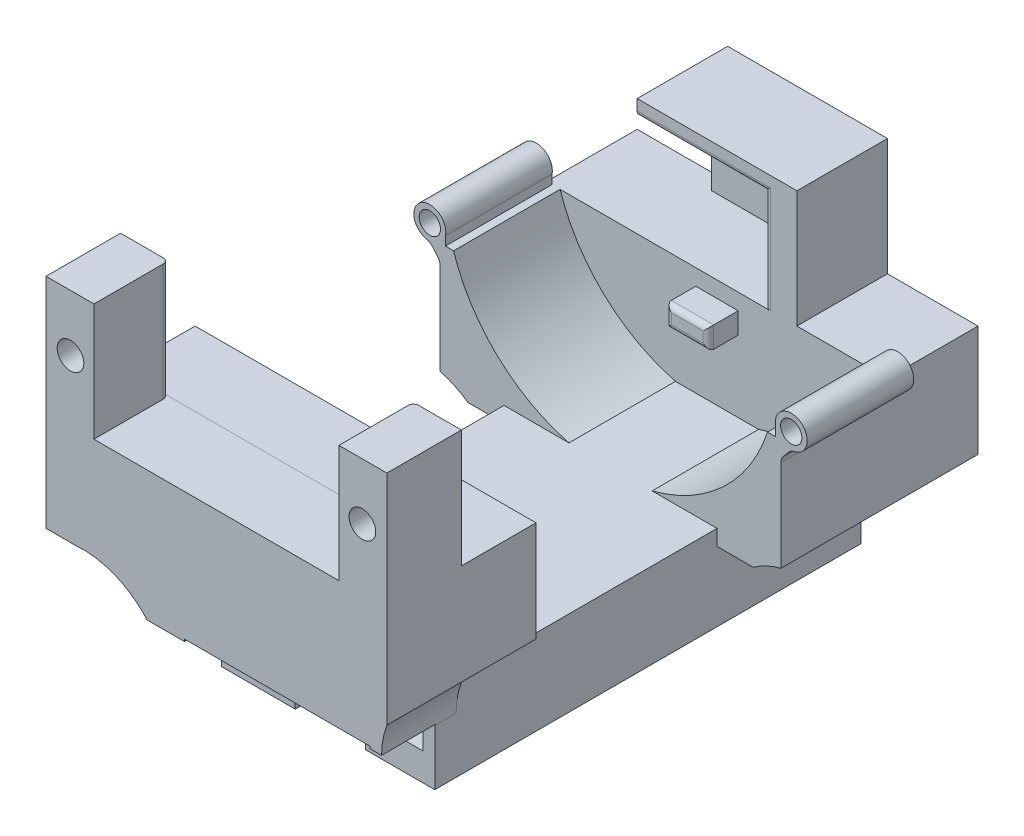
from build123d import *

# Parameters (mm, degrees)
BOSS_EXTRUDE1_DEPTH = 50
SKETCH2_R           = 1.25
BOSS_EXTRUDE2_DEPTH = 7
FILLET1_R           = 8
BOSS_EXTRUDE3_DEPTH = 8.5
SKETCH7_W           = 12
SKETCH7_H           = 9.5
CUT_EXTRUDE1_DEPTH  = 7
BOSS_EXTRUDE4_DEPTH = 10
SKETCH9_W           = 3.98
SKETCH9_H           = 1.98
BOSS_EXTRUDE5_DEPTH = 2.8
SKETCH11_W          = 32
SKETCH11_H          = 9.453112349
BOSS_EXTRUDE6_DEPTH = 7
SKETCH16_R          = 1
BOSS_EXTRUDE7_DEPTH = 10
FILLET2_R           = 1
FILLET4_R           = 0.5
FILLET5_R           = 0.5
FILLET6_R           = 0.5
SKETCH17_R          = 8
CUT_EXTRUDE2_DEPTH  = 61.270972563
SKETCH18_W          = 26.905399266
SKETCH18_H          = 5.924124609
CUT_EXTRUDE3_DEPTH  = 5
SKETCH19_W          = 27.645914842
SKETCH19_H          = 7.775413549
CUT_EXTRUDE4_DEPTH  = 5


with BuildPart() as part:
    # Sketch1 → Boss-Extrude1 (new body)
    with BuildSketch(Plane.XY):
        Polygon((-6.349640288, 0), (-0.949640288, 0), (-0.949640288, -2.6), (-7.849640288, -2.6), (-7.849640288, 5.4), (12.150359712, 5.4), (12.150359712, -2.6), (5.650359712, -2.6), (5.650359712, 0), (11.050359712, 0), (11.050359712, 2.9), (-6.349640288, 2.9), align=None)
    extrude(amount=BOSS_EXTRUDE1_DEPTH)

    # Sketch2 → Boss-Extrude2 (add)
    with BuildSketch(Plane.XY.offset(50)):
        Polygon((-19.349640288, 25.9), (-19.349640288, 5.4), (12.650359712, 5.4), (12.650359712, 25.9), (8.150359712, 25.9), (8.150359712, 14.9), (-14.849640288, 14.9), (-14.849640288, 25.9), align=None)
        with Locations((10.350359712, 20.6)):
            Circle(SKETCH2_R, mode=Mode.SUBTRACT)
        with Locations((-17.049640288, 20.6)):
            Circle(SKETCH2_R, mode=Mode.SUBTRACT)
    extrude(amount=-BOSS_EXTRUDE2_DEPTH)

    # Fillet1
    # the kernel refuses this fillet: 8 mm, written as the material it adds along each edge
    with BuildSketch(Plane(origin=(-7.849640288, 5.4, 43), x_dir=(0, -1, 0), z_dir=(0, 0, 1))) as fillet1_piece_1:
        with BuildLine():
            CenterArc((FILLET1_R, -FILLET1_R), FILLET1_R, 90, 90)
            Line((0, -FILLET1_R), (0, 0))
            Line((0, 0), (FILLET1_R, 0))
        make_face()
    extrude(amount=7)
    with BuildSketch(Plane(origin=(12.150359712, 5.4, 43), x_dir=(0, -1, 0), z_dir=(0, 0, 1))) as fillet1_piece_2:
        with BuildLine():
            CenterArc((2.783882181, 8), FILLET1_R, 249.635865194, 20.364134806)
            Line((0, 0.5), (0, 0))
            Line((0, 0), (2.783882181, 0))
        make_face()
    extrude(amount=7)

    # Sketch4 → Boss-Extrude3 (add)
    with BuildSketch(Plane(origin=(0, 0, 0), x_dir=(-1, 0, 0), z_dir=(0, 0, -1))):
        Polygon((-18.150359712, 15.6), (-18.150359712, 5.1), (13.849640288, 5.1), (13.849640288, 15.6), (5.349640288, 15.6), (5.349640288, 26.6), (-9.650359712, 26.6), (-9.650359712, 15.6), align=None)
    extrude(amount=-BOSS_EXTRUDE3_DEPTH)

    # Sketch7 → Cut-Extrude1 (cut)
    with BuildSketch(Plane.XY.offset(8.5)):
        with Locations((0.650359712, 20.35)):
            Rectangle(SKETCH7_W, SKETCH7_H)
    extrude(amount=-CUT_EXTRUDE1_DEPTH, mode=Mode.SUBTRACT)

    # Sketch8 → Boss-Extrude4 (add)
    with BuildSketch(Plane.XY.offset(8.5)):
        with BuildLine():
            Line((-13.849640288, 15.6), (-12.587686291, 15.6))
            ThreePointArc((-12.587686291, 15.6), (2.150359712, 4.9), (16.888405716, 15.6))
            Line((16.888405716, 15.6), (18.150359712, 15.6))
            Line((18.150359712, 15.6), (18.150359712, 3.937972429))
            Line((18.150359712, 3.937972429), (-13.849640288, 3.937972429))
            Line((-13.849640288, 3.937972429), (-13.849640288, 15.6))
        make_face()
    extrude(amount=BOSS_EXTRUDE4_DEPTH)

    # Sketch9 → Boss-Extrude5 (add)
    with BuildSketch(Plane.XY.offset(8.5)):
        with Locations((2.150359712, 13.1)):
            Rectangle(SKETCH9_W, SKETCH9_H)
    extrude(amount=BOSS_EXTRUDE5_DEPTH)

    # Sketch11 → Boss-Extrude6 (add)
    with BuildSketch(Plane(origin=(0, 0, 43), x_dir=(-1, 0, 0), z_dir=(0, 0, -1))):
        with Locations((3.349640288, 10.126556175)):
            Rectangle(SKETCH11_W, SKETCH11_H)
    extrude(amount=BOSS_EXTRUDE6_DEPTH)

    # Sketch16 → Boss-Extrude7 (add)
    # profile 1 of 2: a face of its own
    with BuildSketch(Plane.XY.offset(18.5)):
        with BuildLine():
            Line((-13.346805139, 15.601949196), (-13.846805139, 15.601949196))
            Line((-13.846805139, 15.601949196), (-13.849640288, 14.1))
            Line((-13.849640288, 14.1), (-14.815015575, 15.247623037))
            ThreePointArc((-14.815015575, 15.247623037), (-15.7608574, 17.911832315), (-13.346805139, 16.44044538))
            Line((-13.346805139, 16.44044538), (-13.346805139, 15.601949196))
        make_face()
        with Locations((-14.815015575, 16.747623037)):
            Circle(SKETCH16_R, mode=Mode.SUBTRACT)
    # profile 2 of 2: a face of its own
    with BuildSketch(Plane.XY.offset(18.5)):
        with BuildLine():
            Line((17.652000257, 15.6), (18.150359712, 15.6))
            Line((18.150359712, 15.6), (18.150359712, 14.1))
            Line((18.150359712, 14.1), (19.116258964, 15.247623037))
            ThreePointArc((19.116258964, 15.247623037), (20.054810716, 17.91771731), (17.652000257, 16.422128892))
            Line((17.652000257, 16.422128892), (17.652000257, 15.6))
        make_face()
        with Locations((19.116258964, 16.747623037)):
            Circle(SKETCH16_R, mode=Mode.SUBTRACT)
    extrude(amount=-BOSS_EXTRUDE7_DEPTH)

    # Fillet2
    fillet2_edges = [part.edges().sort_by_distance(p)[0] for p in [
        (-13.849640288, 14.1, 13.5),
        (-14.815015575, 15.247623037, 13.5),
        (19.116258964, 15.247623037, 13.5),
        (18.150359712, 14.1, 13.5),
    ]]
    fillet(fillet2_edges, radius=FILLET2_R)

    # Fillet4
    fillet4_edges = [part.edges().sort_by_distance(p)[0] for p in [
        (0.160359712, 13.1, 11.3),
        (2.150359712, 12.11, 11.3),
        (4.140359712, 13.1, 11.3),
        (2.150359712, 14.09, 11.3),
    ]]
    fillet(fillet4_edges, radius=FILLET4_R)

    # Fillet5
    fillet5_edges = [part.edges().sort_by_distance(p)[0] for p in [
        (6.650359712, 20.35, 8.5),
        (0.650359712, 25.1, 8.5),
    ]]
    fillet(fillet5_edges, radius=FILLET5_R)

    # Fillet6
    fillet6_edges = [part.edges().sort_by_distance(p)[0] for p in [
        (-14.849640288, 20.4, 43),
        (8.150359712, 20.4, 43),
    ]]
    fillet(fillet6_edges, radius=FILLET6_R)

    # Sketch17 → Cut-Extrude2 (cut, through all)
    with BuildSketch(Plane.XY.offset(50)):
        with Locations((-15.895053234, -2.569483857)):
            Circle(SKETCH17_R)
        with Locations((20.210973801, -2.569483857)):
            Circle(SKETCH17_R)
    extrude(amount=-CUT_EXTRUDE2_DEPTH, mode=Mode.SUBTRACT)

    # Sketch18 → Cut-Extrude3 (cut)
    with BuildSketch(Plane.XY.offset(50)):
        with Locations((1.903783169, -0.265657621)):
            Rectangle(SKETCH18_W, SKETCH18_H)
    extrude(amount=-CUT_EXTRUDE3_DEPTH, mode=Mode.SUBTRACT)

    # Sketch19 → Cut-Extrude4 (cut)
    with BuildSketch(Plane(origin=(0, 0, 0), x_dir=(-1, 0, 0), z_dir=(0, 0, -1))):
        with Locations((-1.944922923, -1.314721353)):
            Rectangle(SKETCH19_W, SKETCH19_H)
    extrude(amount=-CUT_EXTRUDE4_DEPTH, mode=Mode.SUBTRACT)


solid = part.part
